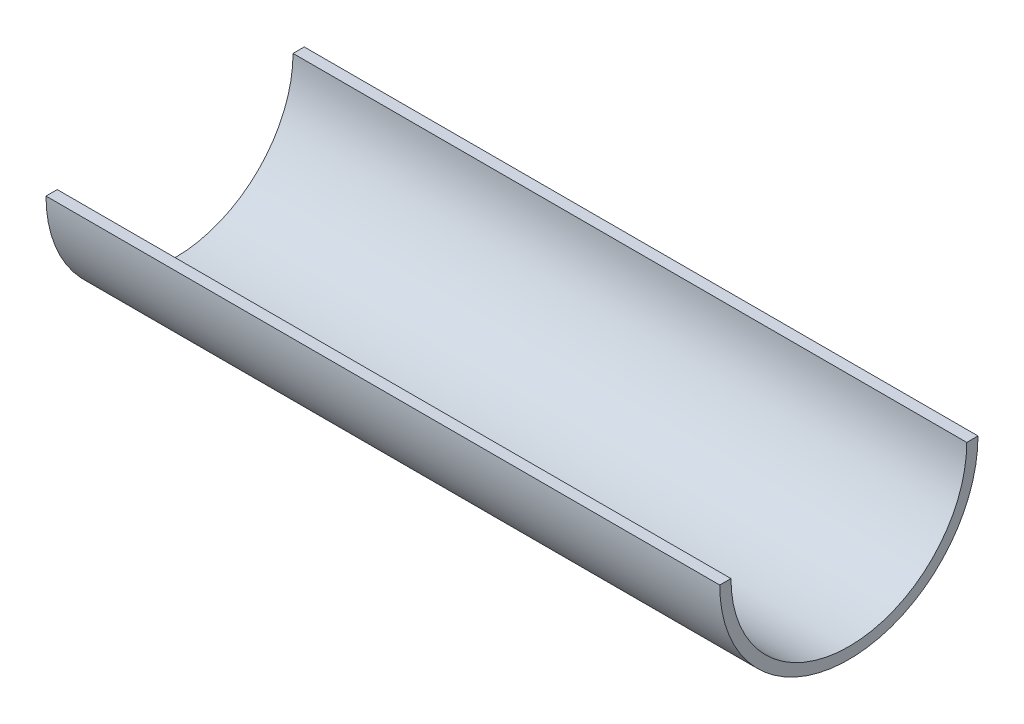
from build123d import *

# Parameters (mm, degrees)
BOSS_EXTRUDE1_DEPTH = 120


with BuildPart() as part:
    # Sketch1 → Boss-Extrude1 (new body)
    with BuildSketch(Plane(origin=(0, 0, 0), x_dir=(0, 0, -1), z_dir=(1, 0, 0))):
        with BuildLine():
            Line((21, 0), (23, 0))
            ThreePointArc((23, 0), (0, -23), (-23, 0))
            Line((-23, 0), (-21, 0))
            ThreePointArc((-21, 0), (0, -21), (21, 0))
        make_face()
    extrude(amount=BOSS_EXTRUDE1_DEPTH)


solid = part.part
